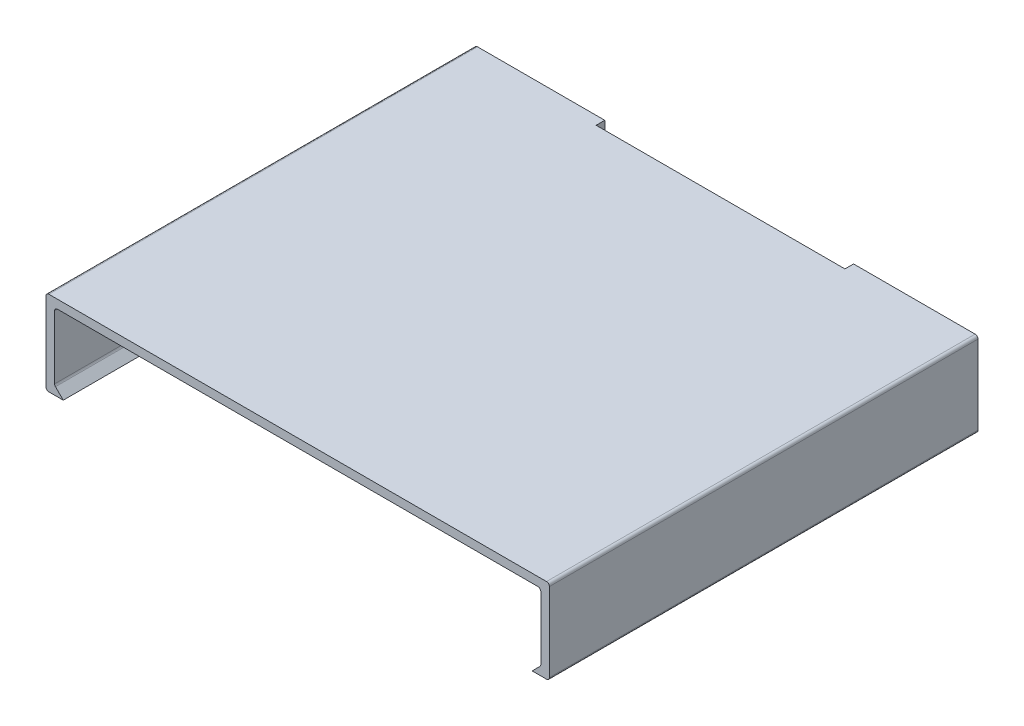
from build123d import *

# Parameters (mm, degrees)
BOSS_EXTRUDE1_DEPTH = 74.5
SKETCH3_W           = 1.5
SKETCH3_H           = 14.7
BOSS_EXTRUDE3_DEPTH = 85
SKETCH4_W           = 43.25
SKETCH4_H           = 14.7
CUT_EXTRUDE1_DEPTH  = 1.5


with BuildPart() as part:
    # Sketch1 → Boss-Extrude1 (new body)
    with BuildSketch(Plane.XY):
        with BuildLine():
            Line((-66.145310525, 10.836426976), (-64.645310525, 10.836426976))
            Line((-64.645310525, 10.836426976), (-65.998863916, 12.189980366))
            ThreePointArc((-65.998863916, 12.189980366), (-66.107250291, 12.352192041), (-66.145310525, 12.543533757))
            Line((-66.145310525, 12.543533757), (-66.145310525, 23.536426976))
            ThreePointArc((-66.145310525, 23.536426976), (-65.998863916, 23.889980366), (-65.645310525, 24.036426976))
            Line((-65.645310525, 24.036426976), (17.854689475, 24.036426976))
            ThreePointArc((17.854689475, 24.036426976), (18.208242865, 23.889980366), (18.354689475, 23.536426976))
            Line((18.354689475, 23.536426976), (18.354689475, 12.543533757))
            ThreePointArc((18.354689475, 12.543533757), (18.316629241, 12.352192041), (18.208242865, 12.189980366))
            Line((18.208242865, 12.189980366), (16.854689475, 10.836426976))
            Line((16.854689475, 10.836426976), (18.354689475, 10.836426976))
            Line((18.354689475, 10.836426976), (19.354689475, 10.836426976))
            ThreePointArc((19.354689475, 10.836426976), (19.708242865, 10.982873585), (19.854689475, 11.336426976))
            Line((19.854689475, 11.336426976), (19.854689475, 25.036426976))
            ThreePointArc((19.854689475, 25.036426976), (19.708242865, 25.389980366), (19.354689475, 25.536426976))
            Line((19.354689475, 25.536426976), (18.354689475, 25.536426976))
            Line((18.354689475, 25.536426976), (-66.145310525, 25.536426976))
            Line((-66.145310525, 25.536426976), (-67.145310525, 25.536426976))
            ThreePointArc((-67.145310525, 25.536426976), (-67.498863916, 25.389980366), (-67.645310525, 25.036426976))
            Line((-67.645310525, 25.036426976), (-67.645310525, 11.336426976))
            ThreePointArc((-67.645310525, 11.336426976), (-67.498863916, 10.982873585), (-67.145310525, 10.836426976))
            Line((-67.145310525, 10.836426976), (-66.145310525, 10.836426976))
        make_face()
    extrude(amount=BOSS_EXTRUDE1_DEPTH)

    # Sketch3 → Boss-Extrude3 (add)
    with BuildSketch(Plane.ZY.offset(-18.354689475)):
        with Locations((0.75, 18.186426976)):
            Rectangle(SKETCH3_W, SKETCH3_H)
    extrude(amount=BOSS_EXTRUDE3_DEPTH)

    # Sketch4 → Cut-Extrude1 (cut)
    with BuildSketch(Plane(origin=(0, 0, 0), x_dir=(-1, 0, 0), z_dir=(0, 0, -1))):
        with Locations((23.395310525, 18.186426976)):
            Rectangle(SKETCH4_W, SKETCH4_H)
    extrude(amount=-CUT_EXTRUDE1_DEPTH, mode=Mode.SUBTRACT)


solid = part.part
